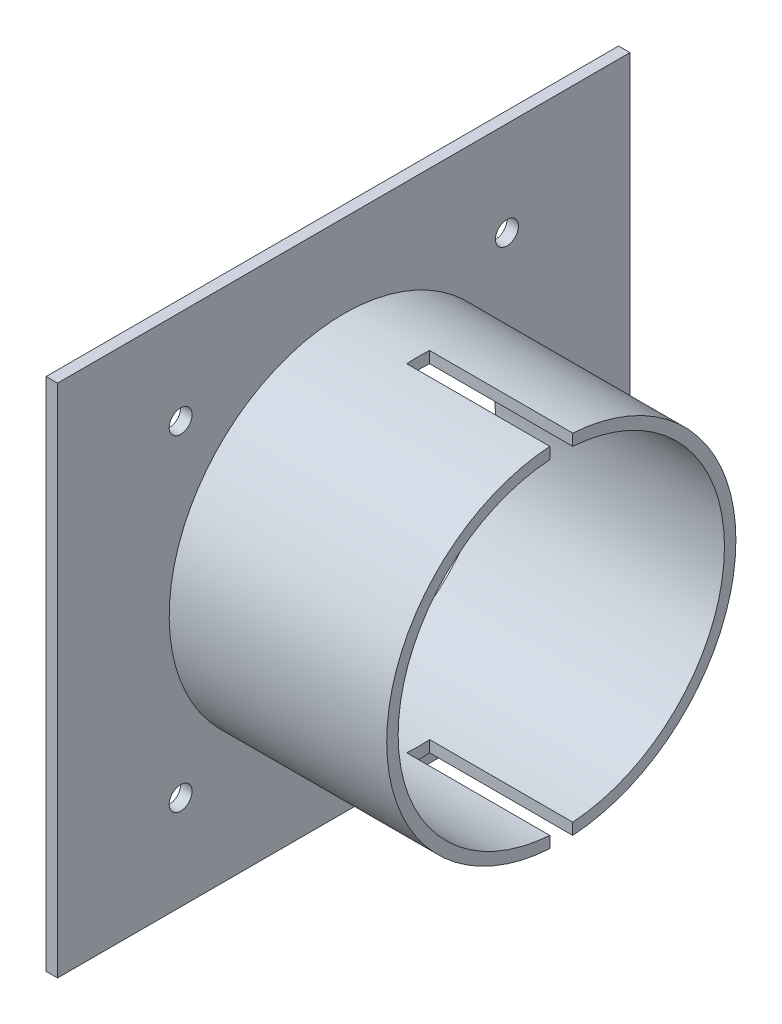
from build123d import *

# Parameters (mm, degrees)
CROQUIS1_W              = 200
CROQUIS1_H              = 180
CROQUIS1_R              = 57
CROQUIS1_R_2            = 4
SALIENTE_EXTRUIR1_DEPTH = 4
CROQUIS2_R              = 61
CROQUIS2_R_2            = 57
SALIENTE_EXTRUIR2_DEPTH = 76
CROQUIS3_W              = 8
CROQUIS3_H              = 23.163617774
CORTAR_EXTRUIR1_DEPTH   = 50


with BuildPart() as part:
    # Croquis1 → Saliente-Extruir1 (new body)
    with BuildSketch(Plane(origin=(0, 0, 0), x_dir=(0, 0, -1), z_dir=(1, 0, 0))):
        Rectangle(CROQUIS1_W, CROQUIS1_H)
        Circle(CROQUIS1_R, mode=Mode.SUBTRACT)
        with Locations((-57, 57)):
            Circle(CROQUIS1_R_2, mode=Mode.SUBTRACT)
        with Locations((57, 57)):
            Circle(CROQUIS1_R_2, mode=Mode.SUBTRACT)
        with Locations((57, -57)):
            Circle(CROQUIS1_R_2, mode=Mode.SUBTRACT)
        with Locations((-57, -57)):
            Circle(CROQUIS1_R_2, mode=Mode.SUBTRACT)
    extrude(amount=SALIENTE_EXTRUIR1_DEPTH)

    # Croquis2 → Saliente-Extruir2 (add)
    with BuildSketch(Plane(origin=(4, 0, 0), x_dir=(0, 0, -1), z_dir=(1, 0, 0))):
        Circle(CROQUIS2_R)
        Circle(CROQUIS2_R_2, mode=Mode.SUBTRACT)
    extrude(amount=SALIENTE_EXTRUIR2_DEPTH)

    # Croquis3 → Cortar-Extruir1 (cut)
    with BuildSketch(Plane(origin=(80, 0, 0), x_dir=(0, 0, -1), z_dir=(1, 0, 0))):
        with Locations((0, 57)):
            Rectangle(CROQUIS3_W, CROQUIS3_H)
        with Locations((0, -57)):
            Rectangle(CROQUIS3_W, CROQUIS3_H)
    extrude(amount=-CORTAR_EXTRUIR1_DEPTH, mode=Mode.SUBTRACT)


solid = part.part
